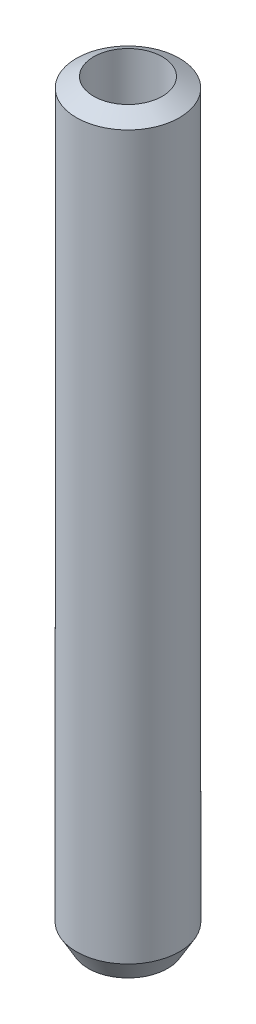
from build123d import *

# Parameters (mm, degrees)
SKETCH1_R           = 22.5
BOSS_EXTRUDE1_DEPTH = 329.735765
SKETCH2_R           = 14.995852291
CUT_EXTRUDE1_DEPTH  = 332.267527416
CHAMFER1_SIZE       = 5.14782
CHAMFER1_SIZE_2     = 8.916286


with BuildPart() as part:
    # Sketch1 → Boss-Extrude1 (new body)
    with BuildSketch(Plane(origin=(0, 0, 0), x_dir=(1, 0, 0), z_dir=(0, 1, 0))):
        with Locations(Location((0, 0, 0), (0, 0, 270))):
            Circle(SKETCH1_R)
    extrude(amount=BOSS_EXTRUDE1_DEPTH)

    # Sketch2 → Cut-Extrude1 (cut, through all)
    with BuildSketch(Plane(origin=(0, 0, 0), x_dir=(1, 0, 0), z_dir=(0, 1, 0))):
        with Locations(Location((0, 0, 0), (0, 0, 270))):
            Circle(SKETCH2_R)
    extrude(amount=CUT_EXTRUDE1_DEPTH, mode=Mode.SUBTRACT)

    # Chamfer1
    # the kernel refuses this chamfer: 8.916286, 5.14782 mm, written as the material it takes off along each edge
    with BuildSketch(Plane(origin=(0, 329.735765, 0), x_dir=(0, 0, 1), z_dir=(-1, 0, 0))) as chamfer1_piece_1:
        Polygon((22.5, -CHAMFER1_SIZE), (22.5 - CHAMFER1_SIZE_2, 0), (22.5, 0), align=None)
    revolve(axis=Axis((0, 329.735765, 0), (0, 1, 0)), mode=Mode.SUBTRACT)
    with BuildSketch(Plane(origin=(0, 0, 0), x_dir=(0, 0, 1), z_dir=(-1, 0, 0))) as chamfer1_piece_2:
        Polygon((22.5, CHAMFER1_SIZE_2), (22.5 - CHAMFER1_SIZE, 0), (22.5, 0), align=None)
    revolve(axis=Axis((0, 0, 0), (0, 1, 0)), mode=Mode.SUBTRACT)


solid = part.part
